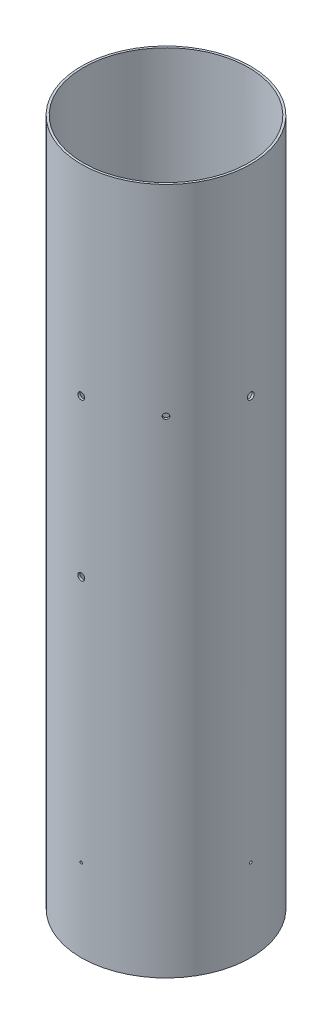
from build123d import *

# Parameters (mm, degrees)
SKETCH2_R                      = 78.359
SKETCH2_R_2                    = 76.3651
BOSS_EXTRUDE1_DEPTH            = 635
SKETCH3_R                      = 1.190625
CUT_EXTRUDE1_DEPTH             = 645.59697933
CIRPATTERN1_COUNT              = 4
SKETCH4_R                      = 3.175
CUT_EXTRUDE2_DEPTH             = 645.596979454
CIRPATTERN2_COUNT              = 4
CUT_EXTRUDE3_REACH             = 664.58
CUT_EXTRUDE3_END_RADIUS        = 76.3651
SKETCH5_R                      = 2.5019
CUT_EXTRUDE3_DIRECTION_2_DEPTH = 663.580045892
CUT_EXTRUDE4_DEPTH             = 645.596979454
CUT_EXTRUDE4_DEPTH_BACK        = 645.596979454
SKETCH6_R                      = 3.175


with BuildPart() as part:
    # Sketch2 → Boss-Extrude1 (new body)
    with BuildSketch(Plane(origin=(0, 0, 0), x_dir=(1, 0, 0), z_dir=(0, 1, 0))):
        Circle(SKETCH2_R)
        Circle(SKETCH2_R_2, mode=Mode.SUBTRACT)
    extrude(amount=BOSS_EXTRUDE1_DEPTH)

    # Sketch3 → Cut-Extrude1 (cut, symmetric)
    with BuildSketch(Plane.XY):
        with Locations((0, 76.2)):
            Circle(SKETCH3_R)
    cut_extrude1 = extrude(amount=CUT_EXTRUDE1_DEPTH, both=True, mode=Mode.SUBTRACT)

    # CirPattern1: Cut-Extrude1 ×4 about axis
    cirpattern1_axis = Axis((0, 635, 0), (0, 1, 0))
    for i in range(1, CIRPATTERN1_COUNT):
        add(cut_extrude1.rotate(cirpattern1_axis, i * 360 / CIRPATTERN1_COUNT), mode=Mode.SUBTRACT)

    # Sketch4 → Cut-Extrude2 (cut, symmetric)
    with BuildSketch(Plane.XY):
        with Locations((0, 449.5038)):
            Circle(SKETCH4_R)
    cut_extrude2 = extrude(amount=CUT_EXTRUDE2_DEPTH, both=True, mode=Mode.SUBTRACT)

    # CirPattern2: Cut-Extrude2 ×4 about axis
    cirpattern2_axis = Axis((0, 635, 0), (0, 1, 0))
    for i in range(1, CIRPATTERN2_COUNT):
        add(cut_extrude2.rotate(cirpattern2_axis, i * 360 / CIRPATTERN2_COUNT), mode=Mode.SUBTRACT)

    # Cut-Extrude3: up to this cylinder (the profile starts outside it)
    cut_extrude3_end = Plane(origin=(0, 449.5038, 0), z_dir=(0, -1, 0)) * Cylinder(CUT_EXTRUDE3_END_RADIUS, 1482.8902, mode=Mode.PRIVATE)
    # Sketch5 → Cut-Extrude3 (cut, up to the surface)
    with BuildSketch(Plane(origin=(55.408180267, 0, 55.408180267), x_dir=(0, -1, 0), z_dir=(0.7071067811865488, 0, 0.7071067811865464)), mode=Mode.PRIVATE) as cut_extrude3_sk1:
        with Locations((-449.5038, 0)):
            Circle(SKETCH5_R)
    cut_extrude3_tool1 = extrude(cut_extrude3_sk1.sketch, amount=-CUT_EXTRUDE3_REACH, mode=Mode.PRIVATE) - cut_extrude3_end
    add(cut_extrude3_tool1.solids().sort_by_distance((55.40818, 449.5038, 55.40818))[0], mode=Mode.SUBTRACT)

    # Sketch5 → Cut-Extrude3 direction 2 (cut)
    with BuildSketch(Plane(origin=(55.408180267, 0, 55.408180267), x_dir=(0, -1, 0), z_dir=(0.7071067811865488, 0, 0.7071067811865464))):
        with Locations((-449.5038, 0)):
            Circle(SKETCH5_R)
    extrude(amount=CUT_EXTRUDE3_DIRECTION_2_DEPTH, mode=Mode.SUBTRACT)

    # Sketch6 → Cut-Extrude4 (cut, two sides: drawn at the far end of the back side and taken through both)
    with BuildSketch(Plane.XY.offset(-CUT_EXTRUDE4_DEPTH_BACK)):
        with Locations((0, 304.8)):
            Circle(SKETCH6_R)
    extrude(amount=CUT_EXTRUDE4_DEPTH + CUT_EXTRUDE4_DEPTH_BACK, mode=Mode.SUBTRACT)


solid = part.part
